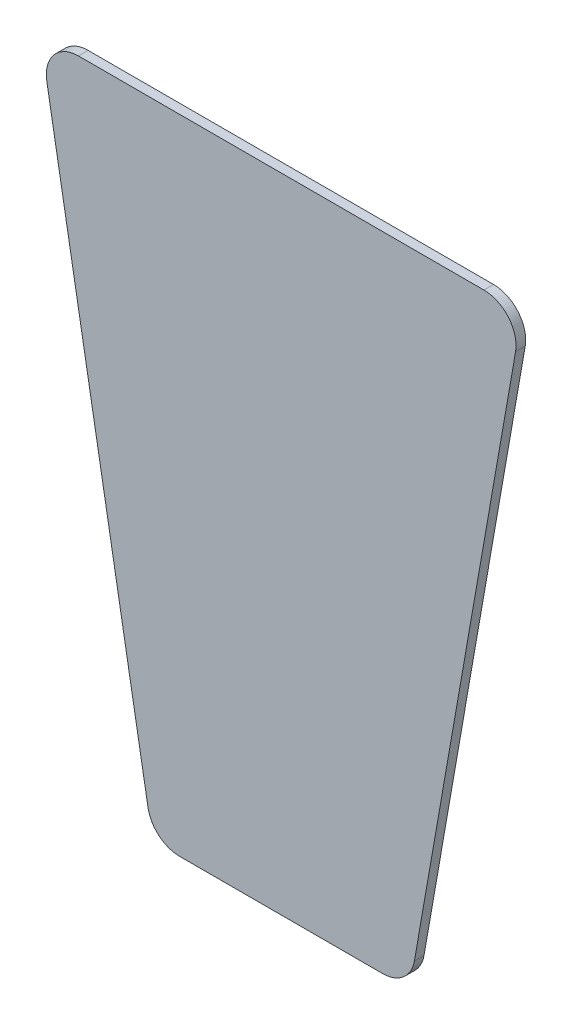
from build123d import *

# Parameters (mm, degrees)
BOSS_EXTRUDE1_DEPTH = 3
FILLET1_R           = 10
FILLET2_R           = 10
FILLET3_R           = 10
FILLET4_R           = 10


with BuildPart() as part:
    # Sketch1 → Boss-Extrude1 (new body)
    with BuildSketch(Plane.XY):
        Polygon((-40, 0), (40, 0), (75, 200), (-75, 200), align=None)
    extrude(amount=BOSS_EXTRUDE1_DEPTH)

    # Fillet1
    fillet1_edges = [part.edges().sort_by_distance(p)[0] for p in [
        (75, 200, 1.5),
    ]]
    fillet(fillet1_edges, radius=FILLET1_R)

    # Fillet2
    fillet2_edges = [part.edges().sort_by_distance(p)[0] for p in [
        (40, 0, 1.5),
    ]]
    fillet(fillet2_edges, radius=FILLET2_R)

    # Fillet3
    fillet3_edges = [part.edges().sort_by_distance(p)[0] for p in [
        (-40, 0, 1.5),
    ]]
    fillet(fillet3_edges, radius=FILLET3_R)

    # Fillet4
    fillet4_edges = [part.edges().sort_by_distance(p)[0] for p in [
        (-75, 200, 1.5),
    ]]
    fillet(fillet4_edges, radius=FILLET4_R)


solid = part.part
